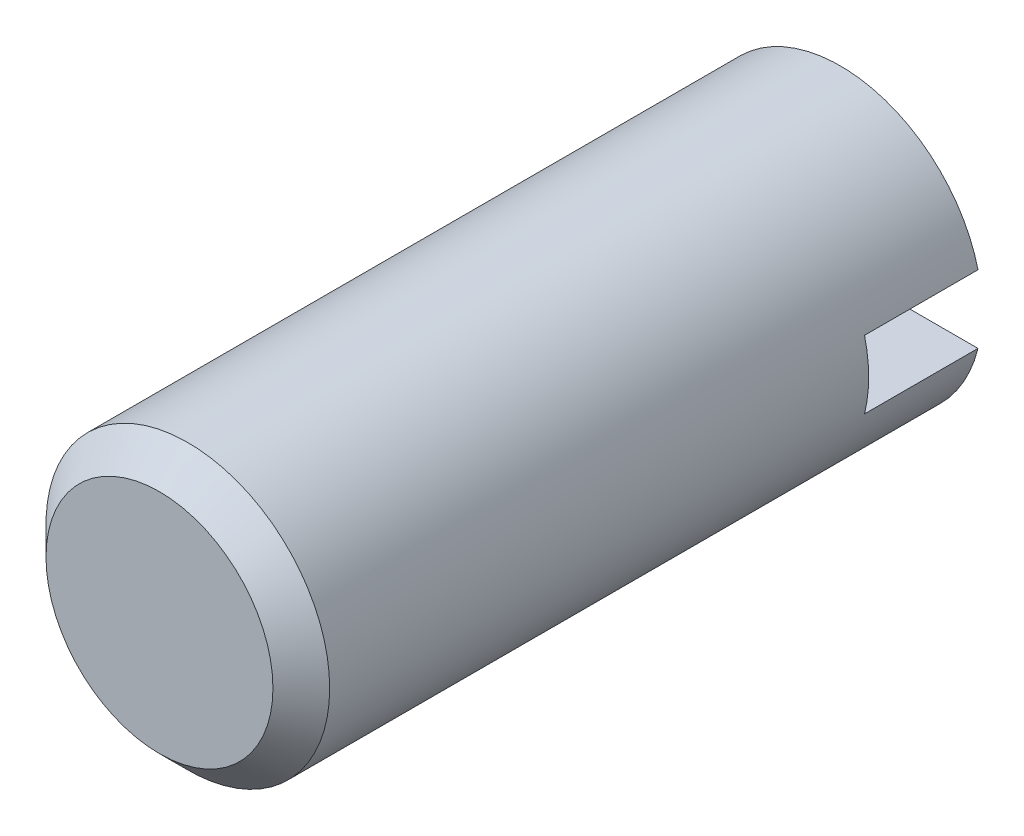
from build123d import *

# Parameters (mm, degrees)
SKETCH2_W          = 5.424806346
SKETCH2_H          = 1.2
CUT_EXTRUDE1_DEPTH = 2


with BuildPart() as part:
    # Sketch1 → Revolve1 (revolve)
    with BuildSketch(Plane(origin=(0, 0, 0), x_dir=(0, 0, -1), z_dir=(1, 0, 0))):
        Polygon((0, 0), (0, 2), (0.5, 2.5), (12, 2.5), (12, 0), align=None)
    revolve(axis=Axis((0, 0, 0), (0, 0, -1)))

    # Sketch2 → Cut-Extrude1 (cut)
    with BuildSketch(Plane(origin=(0, 0, -12), x_dir=(-1, 0, 0), z_dir=(0, 0, -1))):
        Rectangle(SKETCH2_W, SKETCH2_H)
    extrude(amount=-CUT_EXTRUDE1_DEPTH, mode=Mode.SUBTRACT)


solid = part.part
